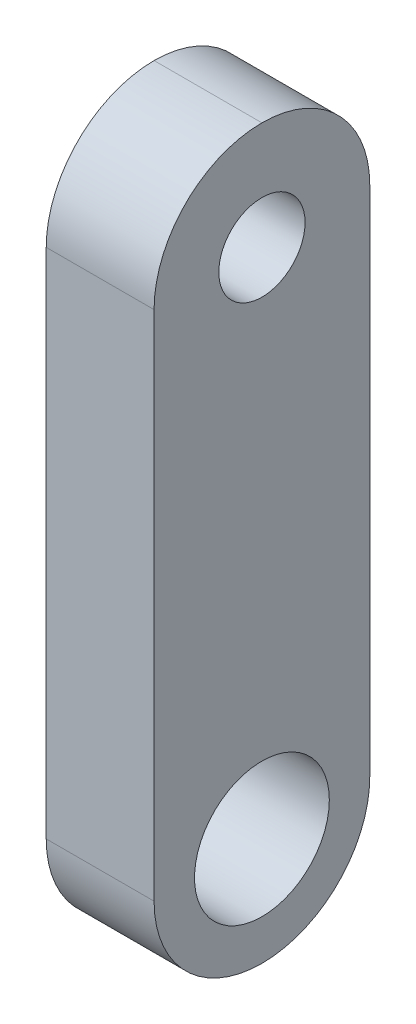
from build123d import *

# Parameters (mm, degrees)
SKETCH1_W           = 8
SKETCH1_H           = 27
BOSS_EXTRUDE1_DEPTH = 4
SKETCH2_R           = 2.5
SKETCH2_R_2         = 1.6
CUT_EXTRUDE1_DEPTH  = 29.442925307
FILLET1_R           = 4


with BuildPart() as part:
    # Sketch1 → Boss-Extrude1 (new body)
    with BuildSketch(Plane(origin=(0, 0, 0), x_dir=(0, 0, -1), z_dir=(1, 0, 0))):
        with Locations((4, -13.5)):
            Rectangle(SKETCH1_W, SKETCH1_H)
    extrude(amount=BOSS_EXTRUDE1_DEPTH)

    # Sketch2 → Cut-Extrude1 (cut, through all)
    with BuildSketch(Plane(origin=(4, 0, 0), x_dir=(0, 0, -1), z_dir=(1, 0, 0))):
        with Locations((4, -23)):
            Circle(SKETCH2_R)
        with Locations((4, -4)):
            Circle(SKETCH2_R_2)
    extrude(amount=-CUT_EXTRUDE1_DEPTH, mode=Mode.SUBTRACT)

    # Fillet1
    fillet1_edges = [part.edges().sort_by_distance(p)[0] for p in [
        (2, -27, -8),
        (2, -27, 0),
        (2, 0, 0),
        (2, 0, -8),
    ]]
    fillet(fillet1_edges, radius=FILLET1_R - 0.0001)  # a hair under: the kernel refuses the full size


solid = part.part
